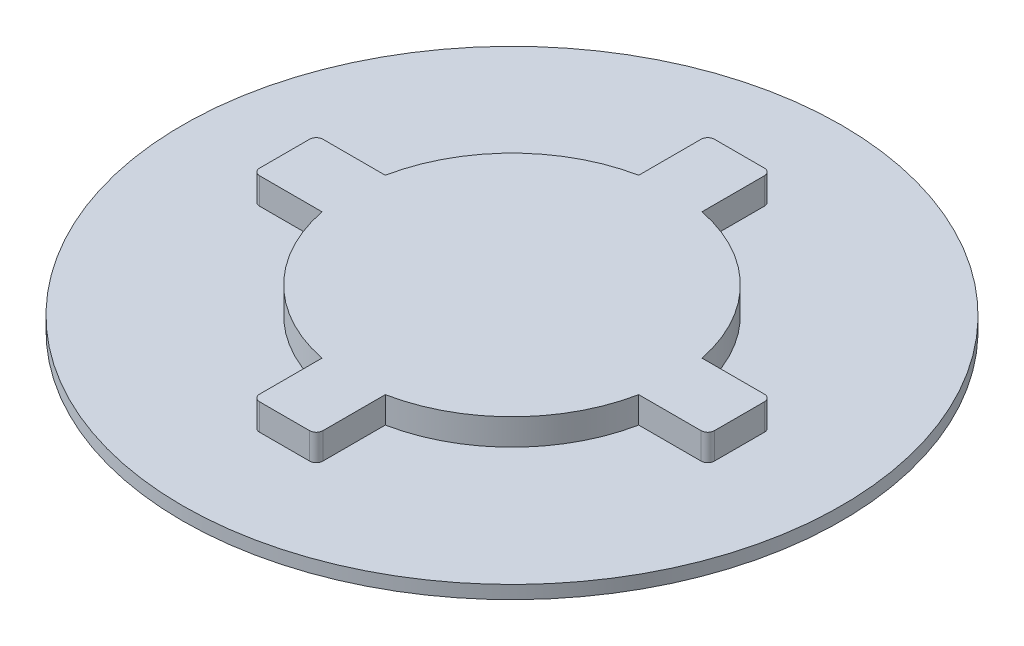
from build123d import *

# Parameters (mm, degrees)
CROQUIS5_R              = 24.5
SALIENTE_EXTRUIR3_DEPTH = 4
SALIENTE_EXTRUIR4_DEPTH = 4
CROQUIS7_R              = 50
SALIENTE_EXTRUIR5_DEPTH = 2
CORTAR_EXTRUIR3_DEPTH   = 2
CROQUIS9_R              = 3.535533906
CORTAR_EXTRUIR4_DEPTH   = 2.5
CROQUIS10_R             = 0.5
CORTAR_EXTRUIR5_DEPTH   = 2


with BuildPart() as part:
    # Croquis5 → Saliente-Extruir3 (new body)
    with BuildSketch(Plane(origin=(0, 0, 0), x_dir=(1, 0, 0), z_dir=(0, 1, 0))):
        Circle(CROQUIS5_R)
    extrude(amount=SALIENTE_EXTRUIR3_DEPTH)

    # Croquis6 → Saliente-Extruir4 (add)
    with BuildSketch(Plane.XZ):
        with BuildLine():
            ThreePointArc((34.5, 3.8), (34.207106781, 4.507106781), (33.5, 4.8))
            Line((33.5, 4.8), (24.025195108, 4.8))
            ThreePointArc((24.025195108, 4.8), (24.5, 0), (24.025195108, -4.8))
            Line((24.025195108, -4.8), (33.5, -4.8))
            ThreePointArc((33.5, -4.8), (34.207106781, -4.507106781), (34.5, -3.8))
            Line((34.5, -3.8), (34.5, 3.8))
        make_face()
        with BuildLine():
            ThreePointArc((-4.8, 24.025195108), (0, 24.5), (4.8, 24.025195108))
            Line((4.8, 24.025195108), (4.8, 33.5))
            ThreePointArc((4.8, 33.5), (4.507106781, 34.207106781), (3.8, 34.5))
            Line((3.8, 34.5), (-3.8, 34.5))
            ThreePointArc((-3.8, 34.5), (-4.507106781, 34.207106781), (-4.8, 33.5))
            Line((-4.8, 33.5), (-4.8, 24.025195108))
        make_face()
        with BuildLine():
            ThreePointArc((-24.025195108, -4.8), (-24.5, 0), (-24.025195108, 4.8))
            Line((-24.025195108, 4.8), (-33.5, 4.8))
            ThreePointArc((-33.5, 4.8), (-34.207106781, 4.507106781), (-34.5, 3.8))
            Line((-34.5, 3.8), (-34.5, -3.8))
            ThreePointArc((-34.5, -3.8), (-34.207106781, -4.507106781), (-33.5, -4.8))
            Line((-33.5, -4.8), (-24.025195108, -4.8))
        make_face()
        with BuildLine():
            Line((4.8, -33.5), (4.8, -24.025195108))
            ThreePointArc((4.8, -24.025195108), (0, -24.5), (-4.8, -24.025195108))
            Line((-4.8, -24.025195108), (-4.8, -33.5))
            ThreePointArc((-4.8, -33.5), (-4.507106781, -34.207106781), (-3.8, -34.5))
            Line((-3.8, -34.5), (3.8, -34.5))
            ThreePointArc((3.8, -34.5), (4.507106781, -34.207106781), (4.8, -33.5))
        make_face()
    extrude(amount=-SALIENTE_EXTRUIR4_DEPTH)

    # Croquis7 → Saliente-Extruir5 (add)
    with BuildSketch(Plane.XZ):
        Circle(CROQUIS7_R)
    extrude(amount=SALIENTE_EXTRUIR5_DEPTH)

    # Croquis8 → Cortar-Extruir3 (cut)
    with BuildSketch(Plane.XZ.offset(2)):
        with BuildLine():
            Line((-2.5, -25), (2.5, -25))
            Line((2.5, -25), (2.5, -19.843134833))
            ThreePointArc((2.5, -19.843134833), (14.142135624, -14.142135624), (19.843134833, -2.5))
            Line((19.843134833, -2.5), (25, -2.5))
            Line((25, -2.5), (25, 2.5))
            Line((25, 2.5), (19.843134833, 2.5))
            ThreePointArc((19.843134833, 2.5), (14.142135624, 14.142135624), (2.5, 19.843134833))
            Line((2.5, 19.843134833), (2.5, 25))
            Line((2.5, 25), (-2.5, 25))
            Line((-2.5, 25), (-2.5, 19.843134833))
            ThreePointArc((-2.5, 19.843134833), (-14.142135624, 14.142135624), (-19.843134833, 2.5))
            Line((-19.843134833, 2.5), (-25, 2.5))
            Line((-25, 2.5), (-25, -2.5))
            Line((-25, -2.5), (-19.843134833, -2.5))
            ThreePointArc((-19.843134833, -2.5), (-14.142135624, -14.142135624), (-2.5, -19.843134833))
            Line((-2.5, -19.843134833), (-2.5, -25))
        make_face()
        with BuildLine():
            ThreePointArc((14.790199458, -2.5), (10.606601718, -10.606601718), (2.5, -14.790199458))
            Line((2.5, -14.790199458), (2.5, -2.5))
            Line((2.5, -2.5), (14.790199458, -2.5))
        make_face(mode=Mode.SUBTRACT)
        with BuildLine():
            ThreePointArc((-2.5, -14.790199458), (-10.606601718, -10.606601718), (-14.790199458, -2.5))
            Line((-14.790199458, -2.5), (-2.5, -2.5))
            Line((-2.5, -2.5), (-2.5, -14.790199458))
        make_face(mode=Mode.SUBTRACT)
        with BuildLine():
            Line((14.790199458, 2.5), (2.5, 2.5))
            Line((2.5, 2.5), (2.5, 14.790199458))
            ThreePointArc((2.5, 14.790199458), (10.606601718, 10.606601718), (14.790199458, 2.5))
        make_face(mode=Mode.SUBTRACT)
        with BuildLine():
            ThreePointArc((-14.790199458, 2.5), (-10.606601718, 10.606601718), (-2.5, 14.790199458))
            Line((-2.5, 14.790199458), (-2.5, 2.5))
            Line((-2.5, 2.5), (-14.790199458, 2.5))
        make_face(mode=Mode.SUBTRACT)
    extrude(amount=-CORTAR_EXTRUIR3_DEPTH, mode=Mode.SUBTRACT)

    # Croquis9 → Cortar-Extruir4 (cut)
    with BuildSketch(Plane.XZ):
        Circle(CROQUIS9_R)
    extrude(amount=-CORTAR_EXTRUIR4_DEPTH, mode=Mode.SUBTRACT)

    # Croquis10 → Cortar-Extruir5 (cut)
    with BuildSketch(Plane.XZ):
        with Locations((-22.5, 0)):
            Circle(CROQUIS10_R)
        with Locations((0, 22.5)):
            Circle(CROQUIS10_R)
        with Locations((22.5, 0)):
            Circle(CROQUIS10_R)
        with Locations((0, -22.5)):
            Circle(CROQUIS10_R)
    extrude(amount=-CORTAR_EXTRUIR5_DEPTH, mode=Mode.SUBTRACT)


solid = part.part
